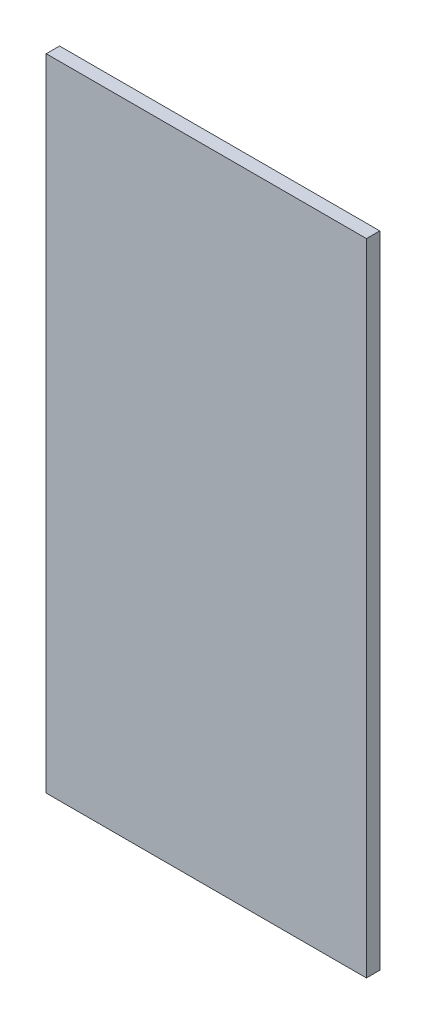
from build123d import *

# Parameters (mm, degrees)
SKETCH1_W           = 152.4
SKETCH1_H           = 304.8
BOSS_EXTRUDE1_DEPTH = 6.35


with BuildPart() as part:
    # Sketch1 → Boss-Extrude1 (new body)
    with BuildSketch(Plane.XY):
        Rectangle(SKETCH1_W, SKETCH1_H)
    extrude(amount=BOSS_EXTRUDE1_DEPTH)


solid = part.part
